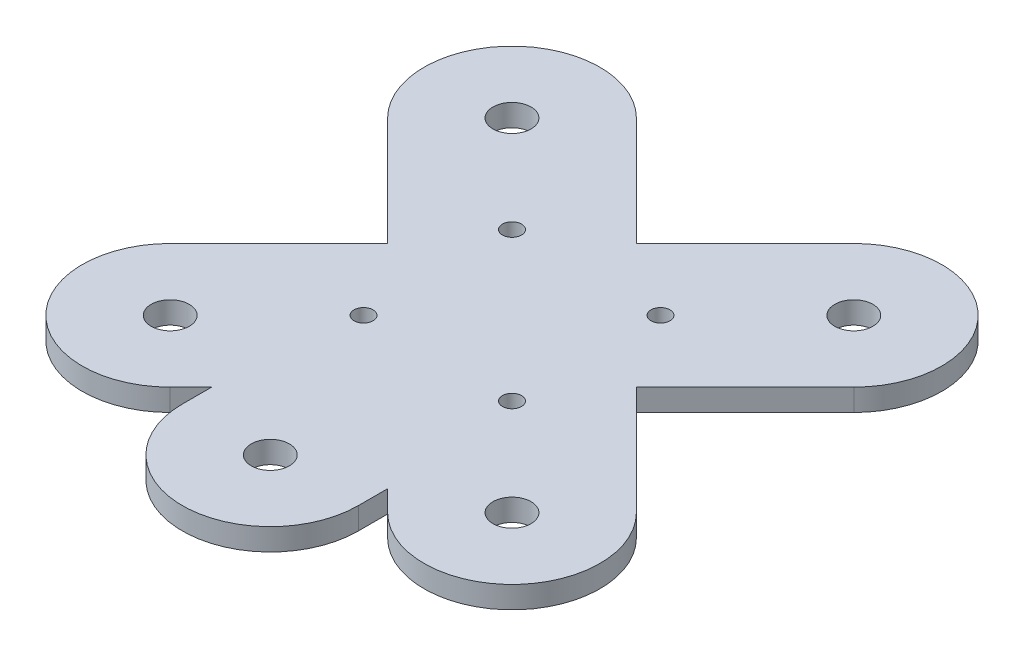
from build123d import *

# Parameters (mm, degrees)
BOSS_EXTRU_1_DEPTH      = 7.5
ENL_V_MAT_EXTRU_1_DEPTH = 2
ESQUISSE5_R             = 3.25
ENL_V_MAT_EXTRU_2_DEPTH = 144.052645944
ESQUISSE7_R             = 6.5
ENL_V_MAT_EXTRU_3_DEPTH = 144.143492733


with BuildPart() as part:
    # Esquisse2 → Boss.-Extru.1 (new body)
    with BuildSketch(Plane(origin=(0, 0, 0), x_dir=(1, 0, 0), z_dir=(0, 1, 0))):
        with BuildLine():
            Line((-42.426406871, 0), (-79.497474683, -37.071067812))
            ThreePointArc((-79.497474683, -37.071067812), (-79.497474683, -79.497474683), (-37.071067812, -79.497474683))
            Line((-37.071067812, -79.497474683), (-30, -72.426406871))
            Line((-30, -72.426406871), (-30, -82.426406871))
            ThreePointArc((-30, -82.426406871), (0, -112.426406871), (30, -82.426406871))
            Line((30, -82.426406871), (30, -72.426406871))
            Line((30, -72.426406871), (37.071067812, -79.497474683))
            ThreePointArc((37.071067812, -79.497474683), (79.497474683, -79.497474683), (79.497474683, -37.071067812))
            Line((79.497474683, -37.071067812), (42.426406871, 0))
            Line((42.426406871, 0), (79.497474683, 37.071067812))
            ThreePointArc((79.497474683, 37.071067812), (79.497474683, 79.497474683), (37.071067812, 79.497474683))
            Line((37.071067812, 79.497474683), (0, 42.426406871))
            Line((0, 42.426406871), (-37.071067812, 79.497474683))
            ThreePointArc((-37.071067812, 79.497474683), (-79.497474683, 79.497474683), (-79.497474683, 37.071067812))
            Line((-79.497474683, 37.071067812), (-42.426406871, 0))
        make_face()
    extrude(amount=BOSS_EXTRU_1_DEPTH)

    # Esquisse4 → Enlèv. mat.-Extru.1 (cut)
    with BuildSketch(Plane(origin=(0, 0, 0), x_dir=(-1, 0, 0), z_dir=(0, -1, 0))):
        with BuildLine():
            Line((-7.639320225, -28.852523661), (-28.852523661, -7.639320225))
            Line((-28.852523661, -7.639320225), (-46.53019319, -25.316989755))
            ThreePointArc((-46.53019319, -25.316989755), (-33.535533906, -33.535533906), (-25.316989755, -46.53019319))
            Line((-25.316989755, -46.53019319), (-7.639320225, -28.852523661))
        make_face()
        with BuildLine():
            ThreePointArc((-25.316989755, 46.53019319), (-33.535533906, 33.535533906), (-46.53019319, 25.316989755))
            Line((-46.53019319, 25.316989755), (-28.852523661, 7.639320225))
            Line((-28.852523661, 7.639320225), (-7.639320225, 28.852523661))
            Line((-7.639320225, 28.852523661), (-25.316989755, 46.53019319))
        make_face()
        with BuildLine():
            ThreePointArc((46.53019319, 25.316989755), (33.535533906, 33.535533906), (25.316989755, 46.53019319))
            Line((25.316989755, 46.53019319), (7.639320225, 28.852523661))
            Line((7.639320225, 28.852523661), (28.852523661, 7.639320225))
            Line((28.852523661, 7.639320225), (46.53019319, 25.316989755))
        make_face()
        with BuildLine():
            ThreePointArc((25.316989755, -46.53019319), (33.535533906, -33.535533906), (46.53019319, -25.316989755))
            Line((46.53019319, -25.316989755), (28.852523661, -7.639320225))
            Line((28.852523661, -7.639320225), (7.639320225, -28.852523661))
            Line((7.639320225, -28.852523661), (25.316989755, -46.53019319))
        make_face()
    extrude(amount=-ENL_V_MAT_EXTRU_1_DEPTH, mode=Mode.SUBTRACT)

    # Esquisse5 → Enlèv. mat.-Extru.2 (cut, through all)
    with BuildSketch(Plane(origin=(0, 2, 0), x_dir=(-1, 0, 0), z_dir=(0, -1, 0))):
        with Locations((-25.316989755, -25.316989755)):
            Circle(ESQUISSE5_R)
        with Locations((-25.316989755, 25.316989755)):
            Circle(ESQUISSE5_R)
        with Locations((25.316989755, 25.316989755)):
            Circle(ESQUISSE5_R)
        with Locations((25.316989755, -25.316989755)):
            Circle(ESQUISSE5_R)
    extrude(amount=-ENL_V_MAT_EXTRU_2_DEPTH, mode=Mode.SUBTRACT)

    # Esquisse7 → Enlèv. mat.-Extru.3 (cut, through all)
    with BuildSketch(Plane(origin=(0, 0, 0), x_dir=(-1, 0, 0), z_dir=(0, -1, 0))):
        with Locations((0, -82.426406871)):
            Circle(ESQUISSE7_R)
        with Locations((-58.284271247, -58.284271247)):
            Circle(ESQUISSE7_R)
        with Locations((-58.284271247, 58.284271247)):
            Circle(ESQUISSE7_R)
        with Locations((58.284271247, 58.284271247)):
            Circle(ESQUISSE7_R)
        with Locations((58.284271247, -58.284271247)):
            Circle(ESQUISSE7_R)
    extrude(amount=-ENL_V_MAT_EXTRU_3_DEPTH, mode=Mode.SUBTRACT)


solid = part.part
